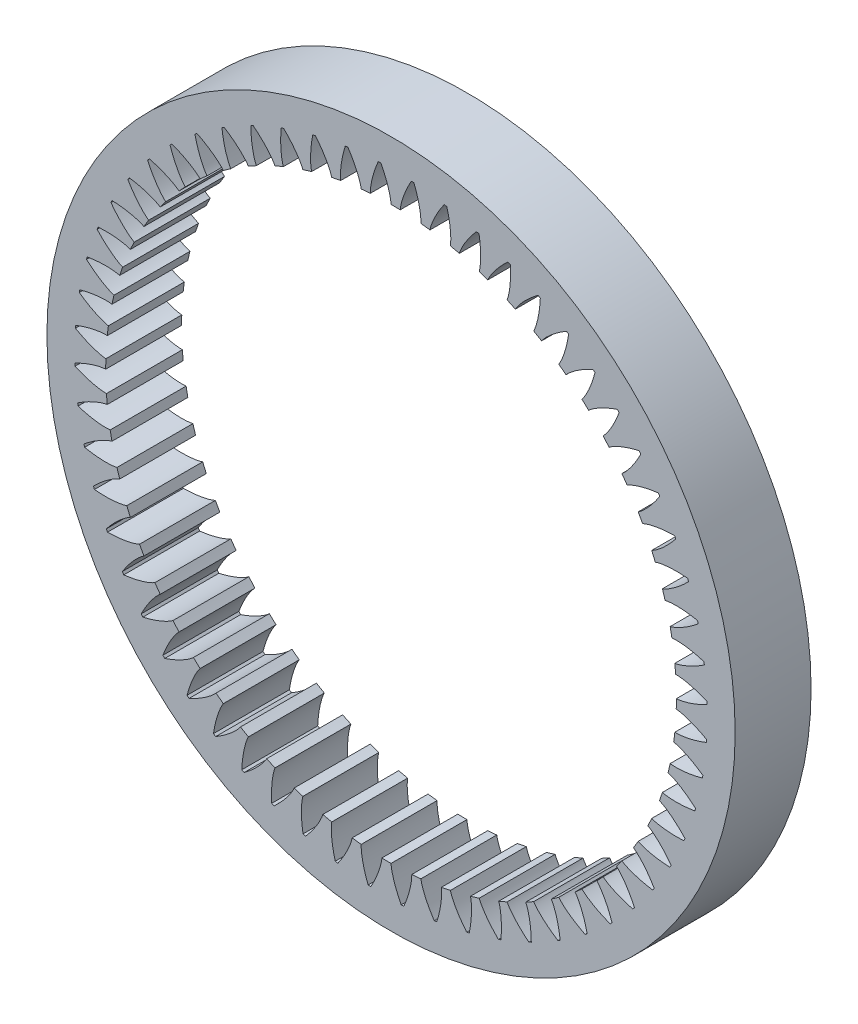
from build123d import *

# Parameters (mm, degrees)
SKETCH1_R           = 68
SKETCH1_R_2         = 56.38
BOSS_EXTRUDE2_DEPTH = 15
CUT_EXTRUDE3_DEPTH  = 15
CIRPATTERN1_COUNT   = 60


with BuildPart() as part:
    # Sketch1 → Boss-Extrude2 (new body)
    with BuildSketch(Plane.XY):
        Circle(SKETCH1_R)
        Circle(SKETCH1_R_2, mode=Mode.SUBTRACT)
    extrude(amount=BOSS_EXTRUDE2_DEPTH)

    # Sketch3 → Cut-Extrude3 (cut)
    with BuildSketch(Plane.XY):
        with BuildLine():
            add(Edge.make_bspline(
                [(56.38, 0), (56.390420481, 0.000110224), (56.419646079, 0.000760808), (56.474891874, 0.003339193), (56.56502004, 0.009462002), (56.679819912, 0.020079687), (56.828139425, 0.037037703), (57.002764014, 0.061175425), (57.194546313, 0.092062), (57.403036743, 0.130371557), (57.610873447, 0.172752962), (57.818029407, 0.218905128), (58.024220747, 0.268374668), (58.273763156, 0.332428727), (58.572665504, 0.414977095), (58.921509337, 0.51982966), (59.316484569, 0.648621108), (59.718249757, 0.790440113), (60.112918483, 0.938665595), (60.510842081, 1.09840308), (60.895257324, 1.260024548), (61.293615356, 1.438118028), (61.660848439, 1.607702847), (62.030638024, 1.789117365), (62.252889862, 1.900105863), (62.407720075, 1.979912723), (62.467636196, 2.011076361)],
                knots=[0, 0, 0, 0, 0, 0.005376749, 0.015083688, 0.02853182, 0.04661014, 0.064854849, 0.092110526, 0.119476176, 0.146842496, 0.174208854, 0.201574956, 0.228941013, 0.256307345, 0.307035032, 0.361767352, 0.416499661, 0.471231937, 0.525964282, 0.580696616, 0.635428982, 0.690161387, 0.744893688, 0.799626082, 0.832728016, 0.832728016, 0.832728016, 0.832728016, 0.832728016], degree=4))
            ThreePointArc((62.467636196, 2.011076361), (62.458707787, 2.271524059), (62.448693493, 2.531932264))
            add(Edge.make_bspline(
                [(62.448693493, 2.531932264), (62.386671911, 2.558661222), (62.226453503, 2.627010263), (61.996726529, 2.721561009), (61.614735778, 2.87563447), (61.236154095, 3.01809519), (60.825911613, 3.166781152), (60.430771625, 3.300051434), (60.022295823, 3.430461453), (59.617902535, 3.549626318), (59.206896903, 3.661886138), (58.803609621, 3.761646045), (58.448070805, 3.840881332), (58.143961731, 3.901499131), (57.890425635, 3.947257024), (57.681185513, 3.981617981), (57.471224296, 4.012600258), (57.260858044, 4.039772285), (57.050135575, 4.062835734), (56.856616308, 4.079709503), (56.680699666, 4.091098597), (56.531540144, 4.097237773), (56.416272277, 4.099488259), (56.325937449, 4.099047916), (56.270650309, 4.097606393), (56.24145466, 4.096132289), (56.231053702, 4.09548527)],
                knots=[0.211975815, 0.211975815, 0.211975815, 0.211975815, 0.211975815, 0.245077749, 0.299810143, 0.354542444, 0.409274849, 0.464007215, 0.518739549, 0.573471894, 0.62820417, 0.682936479, 0.737668799, 0.788396486, 0.815762818, 0.843128875, 0.870494977, 0.897861335, 0.925227655, 0.952593305, 0.979848981, 0.998093691, 1.016172011, 1.029620143, 1.039327082, 1.044703831, 1.044703831, 1.044703831, 1.044703831, 1.044703831], degree=4))
            ThreePointArc((56.231053702, 4.09548527), (56.342751121, 2.049096423), (56.38, 0))
        make_face()
    cut_extrude3 = extrude(amount=CUT_EXTRUDE3_DEPTH, mode=Mode.SUBTRACT)

    # CirPattern1: Cut-Extrude3 ×60 about axis
    cirpattern1_axis = Axis((0, 0, 15), (0, 0, 1))
    for i in range(1, CIRPATTERN1_COUNT):
        add(cut_extrude3.rotate(cirpattern1_axis, i * 360 / CIRPATTERN1_COUNT), mode=Mode.SUBTRACT)


solid = part.part
